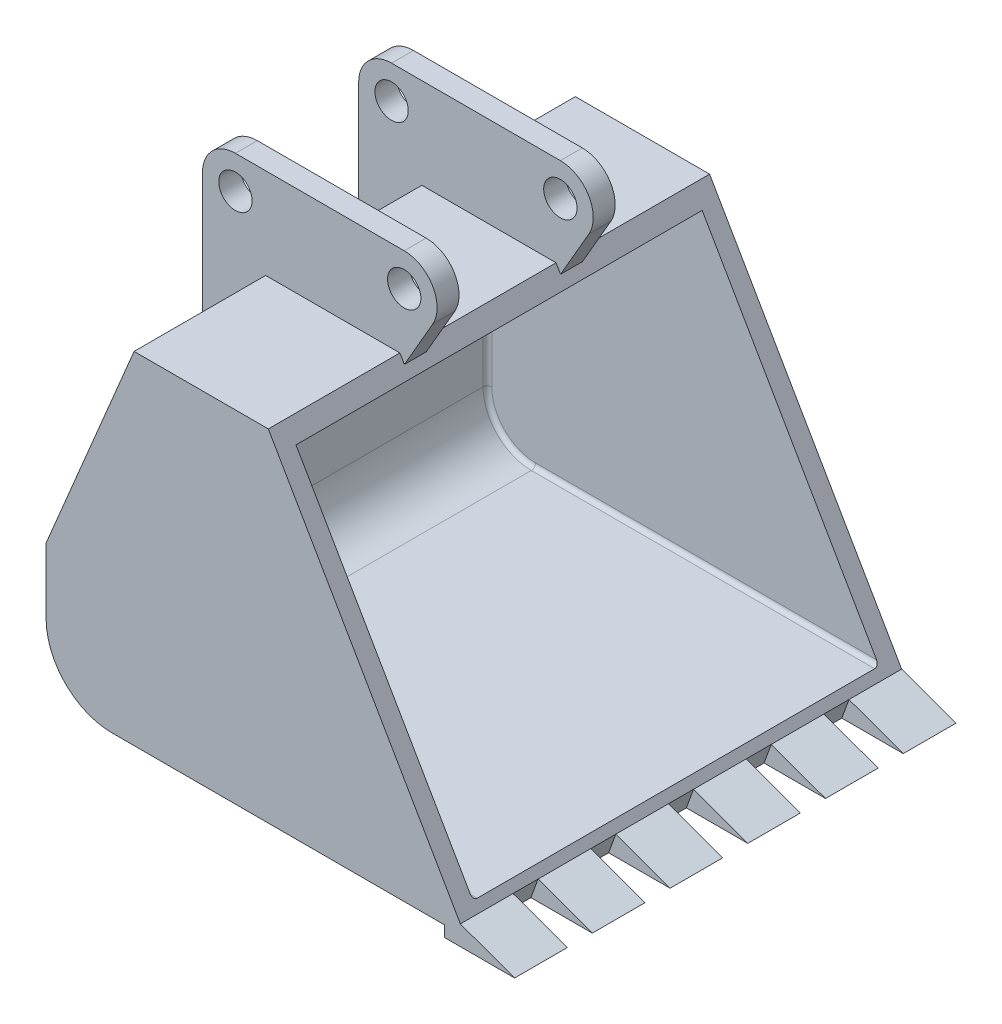
from build123d import *

# Parameters (mm, degrees)
BOSS_EXTRUDE2_DEPTH = 503
SHELL1_START        = -463
SHELL1_DEPTH        = 926
FILLET1_R           = 10
SKETCH8_W           = 131.571198008
SKETCH8_H           = 57.2
CUT_EXTRUDE5_DEPTH  = 1006
LPATTERN1_COUNT     = 5
LPATTERN1_PITCH     = 177.2
BOSS_EXTRUDE4_START = -350
SKETCH12_R          = 38
BOSS_EXTRUDE4_DEPTH = 50


# Read off the part's stored shape, not the designer's step: Shell1
with BuildPart() as part:
    # Sketch1 → Boss-Extrude2 (new, symmetric)
    with BuildSketch(Plane.XY):
        with BuildLine():
            ThreePointArc((-150, 150), (-106.066017178, 43.933982822), (0, 0))
            Line((0, 0), (758, 0))
            Line((758, 0), (758, -25))
            Line((758, -25), (777.984855583, -25))
            Line((777.984855583, -25), (794.363516125, 20))
            Line((794.363516125, 20), (356.523002694, 778.362014874))
            Line((356.523002694, 778.362014874), (50.523002694, 778.362014874))
            Line((50.523002694, 778.362014874), (-150, 300))
            Line((-150, 300), (-150, 150))
        make_face()
        Polygon((794.363516125, 20), (777.984855583, -25), (918, -25), align=None)
    extrude(amount=BOSS_EXTRUDE2_DEPTH, both=True)

    # Shell1 outline → Shell1 (cut)
    with BuildSketch(Plane.XY.offset(SHELL1_START)):
        with BuildLine():
            ThreePointArc((-110, 150), (-77.781745931, 72.218254069), (0, 40))
            Line((0, 40), (782.816510741, 40))
            Line((782.816510741, 40), (379.617013461, 738.362014874))
            Line((379.617013461, 738.362014874), (77.127737155, 738.362014874))
            Line((77.127737155, 738.362014874), (-110, 291.955367349))
            Line((-110, 291.955367349), (-110, 150))
        make_face()
    extrude(amount=SHELL1_DEPTH, mode=Mode.SUBTRACT)

    # Fillet1
    fillet1_edges = [part.edges().sort_by_distance(p)[0] for p in [
        (-77.781745931, 72.218254069, 463),
        (391.408255371, 40, -463),
        (-16.436131422, 515.158691112, 463),
        (-110, 220.977683675, 463),
        (391.408255371, 40, 463),
        (-77.781745931, 72.218254069, -463),
        (-110, 220.977683675, -463),
        (-16.436131422, 515.158691112, -463),
    ]]
    fillet(fillet1_edges, radius=FILLET1_R)

    # Sketch8 → Cut-Extrude5 (cut)
    with BuildSketch(Plane(origin=(99.350755487, 272.963957307, 0), x_dir=(0.9396926207859106, -0.3420201433256628, 0), z_dir=(0.34202014332566283, 0.9396926207859106, 0))):
        with Locations((805.402730461, 354.4)):
            Rectangle(SKETCH8_W, SKETCH8_H)
    cut_extrude5 = extrude(amount=-CUT_EXTRUDE5_DEPTH, mode=Mode.SUBTRACT)

    # LPattern1: Cut-Extrude5 ×5
    with Locations(*[(0, 0, i * LPATTERN1_PITCH) for i in range(1, LPATTERN1_COUNT)]):
        add(cut_extrude5, mode=Mode.SUBTRACT)

    # Sketch12 → Boss-Extrude4 (add)
    with BuildSketch(Plane.XY.offset(503).offset(BOSS_EXTRUDE4_START)):
        with BuildLine():
            Line((366.724091876, 760.693210118), (431.275772112, 872.5))
            ThreePointArc((431.275772112, 872.5), (431.275772112, 947.5), (366.323866828, 985))
            Line((366.323866828, 985), (-18.476997306, 985))
            ThreePointArc((-18.476997306, 985), (-71.510005895, 963.033008589), (-93.476997306, 910))
            Line((-93.476997306, 910), (-93.476997306, 434.839679698))
            Line((-93.476997306, 434.839679698), (50.523002694, 778.362014874))
            Line((50.523002694, 778.362014874), (356.523002694, 778.362014874))
            Line((356.523002694, 778.362014874), (366.724091876, 760.693210118))
        make_face()
        with Locations((-18.476997306, 910)):
            Circle(SKETCH12_R, mode=Mode.SUBTRACT)
        with Locations((366.323866828, 910)):
            Circle(SKETCH12_R, mode=Mode.SUBTRACT)
    boss_extrude4 = extrude(amount=BOSS_EXTRUDE4_DEPTH)

    # Mirror2: Boss-Extrude4 across plane
    add(boss_extrude4.mirror(Plane.XY))


solid = part.part
